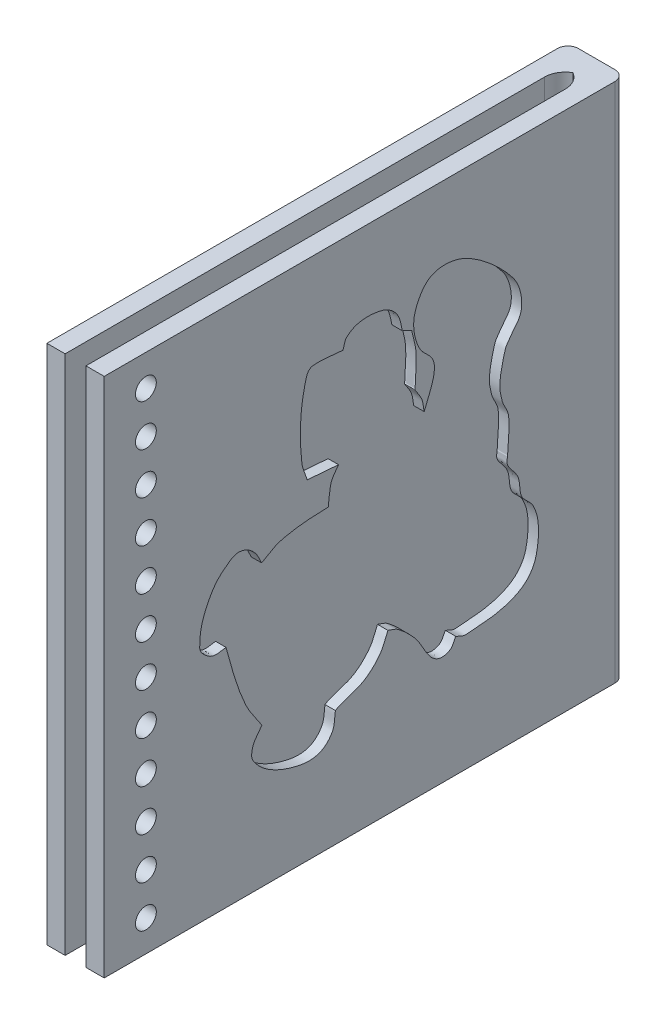
from build123d import *

# Parameters (mm, degrees)
SKETCH1_W           = 2.75
SKETCH1_H           = 25
BOSS_EXTRUDE1_DEPTH = 25
SKETCH2_W           = 1
SKETCH2_H           = 25
CUT_EXTRUDE1_DEPTH  = 24
FILLET2_R           = 1
CUT_EXTRUDE4_START  = 1.375
CUT_EXTRUDE4_DEPTH  = 0.5
FILLET3_R           = 0.5
SKETCH7_R           = 0.5
CUT_EXTRUDE5_DEPTH  = 10


with BuildPart() as part:
    # Sketch1 → Boss-Extrude1 (new body)
    with BuildSketch(Plane.XY):
        Rectangle(SKETCH1_W, SKETCH1_H)
    extrude(amount=BOSS_EXTRUDE1_DEPTH)

    # Sketch2 → Cut-Extrude1 (cut)
    with BuildSketch(Plane.XY.offset(25)):
        Rectangle(SKETCH2_W, SKETCH2_H)
    extrude(amount=-CUT_EXTRUDE1_DEPTH, mode=Mode.SUBTRACT)

    # Fillet2
    # the kernel refuses this fillet: 1 mm, written as the material it adds along each edge
    with BuildSketch(Plane(origin=(0.5, 12.5, 1), x_dir=(-1, 0, 0), z_dir=(0, -1, 0))) as fillet2_piece_1:
        with BuildLine():
            CenterArc((FILLET2_R, -FILLET2_R), FILLET2_R, 90, 90)
            Line((0, -FILLET2_R), (0, 0))
            Line((0, 0), (FILLET2_R, 0))
        make_face()
    extrude(amount=25)
    with BuildSketch(Plane(origin=(-0.5, -12.5, 1), x_dir=(0, 0, 1), z_dir=(0, 1, 0))) as fillet2_piece_2:
        with BuildLine():
            CenterArc((FILLET2_R, FILLET2_R), FILLET2_R, 180, 90)
            Line((0, FILLET2_R), (0, 0))
            Line((0, 0), (FILLET2_R, 0))
        make_face()
    extrude(amount=25)

    # Sketch6 → Cut-Extrude4 (cut)
    with BuildSketch(Plane(origin=(0, 0, 0), x_dir=(0, 0, -1), z_dir=(1, 0, 0)).offset(CUT_EXTRUDE4_START)):
        with BuildLine():
            Line((-13.75659598, 3.208094703), (-15.25659598, 3.328094703))
            add(Edge.make_bspline(
                [(-15.25659598, 3.328094703), (-15.34159598, 3.598094703), (-15.478059231, 3.857024807), (-15.51159598, 4.138094703), (-15.583906266, 4.744123764), (-15.610639421, 5.359017032), (-15.57159598, 5.968094703), (-15.535260245, 6.534932171), (-15.444836525, 7.102581248), (-15.28659598, 7.648094703), (-15.249167055, 7.777126), (-15.134978357, 7.91699683), (-15.00159598, 7.933094703), (-14.519450844, 7.991284633), (-14.03159598, 7.883094703), (-13.54659598, 7.858094703)],
                knots=[0, 0, 0, 0, 1, 1, 1, 2, 2, 2, 3, 3, 3, 4, 4, 4, 5, 5, 5, 5], degree=3))
            add(Edge.make_bspline(
                [(-13.54659598, 7.858094703), (-13.48159598, 8.013094703), (-13.476741249, 8.210895497), (-13.35159598, 8.323094703), (-13.166723721, 8.488842246), (-12.922480212, 8.603584636), (-12.67659598, 8.638094703), (-12.334048727, 8.686171511), (-11.974306488, 8.657718792), (-11.64159598, 8.563094703), (-11.412157478, 8.497841551), (-11.197922131, 8.353267216), (-11.04159598, 8.173094703), (-10.804491339, 7.899821558), (-10.762009421, 7.570161907), (-10.69659598, 7.243094703)],
                knots=[0, 0, 0, 0, 1, 1, 1, 2, 2, 2, 3, 3, 3, 4, 4, 4, 5, 5, 5, 5], degree=3))
            Line((-10.69659598, 7.243094703), (-10.24659598, 7.033094703))
            add(Edge.make_bspline(
                [(-10.24659598, 7.033094703), (-10.17659598, 6.693094703), (-10.059548306, 6.359466167), (-10.03659598, 6.013094703), (-10.004181978, 5.523937947), (-10.062196157, 5.032940237), (-10.08159598, 4.543094703), (-10.082221683, 4.5272957), (-10.10394565, 4.512094073), (-10.09659598, 4.498094703), (-9.99654865, 4.307528359), (-9.845622127, 4.143294274), (-9.76659598, 3.943094703), (-9.693507703, 3.757937733), (-9.68659598, 3.553094703), (-9.64659598, 3.358094703)],
                knots=[0, 0, 0, 0, 1, 1, 1, 2, 2, 2, 3, 3, 3, 4, 4, 4, 5, 5, 5, 5], degree=3))
            add(Edge.make_bspline(
                [(-9.64659598, 3.358094703), (-9.49659598, 3.768094703), (-9.288520046, 4.161304396), (-9.19659598, 4.588094703), (-9.146018675, 4.822917905), (-9.129038173, 5.088589637), (-9.22659598, 5.308094703), (-9.360760059, 5.60996388), (-9.700743832, 5.781830033), (-9.85659598, 6.073094703), (-10.011822034, 6.363189295), (-10.108585544, 6.690741208), (-10.14159598, 7.018094703), (-10.169907425, 7.298849867), (-10.138982996, 7.595146231), (-10.03659598, 7.858094703), (-9.913309024, 8.174718023), (-9.742862161, 8.495862148), (-9.48159598, 8.713094703), (-9.271261927, 8.887979197), (-8.975049206, 8.961142503), (-8.70159598, 8.968094703), (-8.364362395, 8.976668438), (-8.017342873, 8.900638863), (-7.71159598, 8.758094703), (-7.264149639, 8.549487963), (-6.857104165, 8.253592134), (-6.48159598, 7.933094703), (-6.067318292, 7.579507377), (-5.679685309, 7.186573078), (-5.35659598, 6.748094703), (-5.182509496, 6.511834474), (-5.069657746, 6.22576436), (-5.01159598, 5.938094703), (-4.957179545, 5.668486002), (-4.938146197, 5.373530177), (-5.02659598, 5.113094703), (-5.126052852, 4.82024947), (-5.382439364, 4.607007892), (-5.55159598, 4.348094703), (-5.627580506, 4.231791858), (-5.72326723, 4.121627122), (-5.76159598, 3.988094703), (-5.879821683, 3.576211609), (-5.985172366, 3.155455858), (-6.01659598, 2.728094703), (-6.035834132, 2.466455842), (-5.979192538, 2.201581794), (-5.91159598, 1.948094703), (-5.838150825, 1.67267537), (-5.628462394, 1.43635171), (-5.59659598, 1.153094703), (-5.536762273, 0.621239528), (-5.622321636, 0.082957769), (-5.64159598, -0.451905297), (-5.6423384, -0.472507452), (-5.65659598, -0.491289769), (-5.65659598, -0.511905297), (-5.65659598, -0.632009418), (-5.692304606, -0.763030895), (-5.64159598, -0.871905297), (-5.51688444, -1.139668311), (-5.2593142, -1.333876721), (-5.14659598, -1.606905297), (-5.029848014, -1.889694816), (-5.095826647, -2.229597824), (-4.96659598, -2.506905297), (-4.848153364, -2.76106341), (-4.555883166, -2.903088449), (-4.42659598, -3.151905297), (-4.285044038, -3.424326015), (-4.192864316, -3.730641264), (-4.17159598, -4.036905297), (-4.142053328, -4.462319485), (-4.174624176, -4.89783797), (-4.27659598, -5.311905297), (-4.342917918, -5.581212557), (-4.479525035, -5.842138451), (-4.66659598, -6.046905297), (-4.861147332, -6.259860155), (-5.118927955, -6.419416562), (-5.38659598, -6.526905297), (-5.763597062, -6.678299432), (-6.166720467, -6.778352077), (-6.57159598, -6.811905297), (-7.789953763, -6.912874174), (-7.65215886, -6.976623857), (-8.13159598, -6.736905297)],
                knots=[0, 0, 0, 0, 1, 1, 1, 2, 2, 2, 3, 3, 3, 4, 4, 4, 5, 5, 5, 6, 6, 6, 7, 7, 7, 8, 8, 8, 9, 9, 9, 10, 10, 10, 11, 11, 11, 12, 12, 12, 13, 13, 13, 14, 14, 14, 15, 15, 15, 16, 16, 16, 17, 17, 17, 18, 18, 18, 19, 19, 19, 20, 20, 20, 21, 21, 21, 22, 22, 22, 23, 23, 23, 24, 24, 24, 25, 25, 25, 26, 26, 26, 27, 27, 27, 28, 28, 28, 29, 29, 29, 29], degree=3))
            add(Edge.make_bspline(
                [(-8.13159598, -6.736905297), (-8.22159598, -6.876905297), (-8.26436961, -7.062730336), (-8.40159598, -7.156905297), (-8.540667701, -7.252346674), (-8.730903679, -7.293465735), (-8.89659598, -7.261905297), (-9.071012952, -7.228683016), (-9.23263856, -7.113062215), (-9.34659598, -6.976905297), (-9.625216523, -6.644008025), (-9.778150445, -6.219066296), (-10.05159598, -5.881905297), (-10.29661073, -5.579799732), (-10.582513679, -5.308058067), (-10.89159598, -5.071905297), (-11.034017705, -4.963088698), (-11.22159598, -4.931905297), (-11.38659598, -4.861905297)],
                knots=[0, 0, 0, 0, 1, 1, 1, 2, 2, 2, 3, 3, 3, 4, 4, 4, 5, 5, 5, 6, 6, 6, 6], degree=3))
            add(Edge.make_bspline(
                [(-11.38659598, -4.861905297), (-11.51659598, -5.131905297), (-11.594914061, -5.433595246), (-11.77659598, -5.671905297), (-11.986836337, -5.947675115), (-12.243642088, -6.199497636), (-12.54159598, -6.376905297), (-12.910187156, -6.596371798), (-13.344206699, -6.680329435), (-13.74159598, -6.841905297), (-13.799631993, -6.865502357), (-13.85159598, -6.901905297), (-13.90659598, -6.931905297)],
                knots=[0, 0, 0, 0, 1, 1, 1, 2, 2, 2, 3, 3, 3, 4, 4, 4, 4], degree=3))
            add(Edge.make_bspline(
                [(-13.90659598, -6.931905297), (-13.95659598, -7.201905297), (-13.926412623, -7.500136205), (-14.05659598, -7.741905297), (-14.184030979, -7.978570294), (-14.392540831, -8.195803702), (-14.64159598, -8.296905297), (-14.929428763, -8.413748308), (-15.26647199, -8.415209244), (-15.57159598, -8.356905297), (-16.067135074, -8.262216298), (-16.56050565, -8.100578757), (-16.99659598, -7.846905297), (-17.342055911, -7.645951481), (-17.662556052, -7.365551492), (-17.86659598, -7.021905297), (-17.971287551, -6.845582652), (-17.919234057, -6.600490138), (-17.85159598, -6.406905297), (-17.768347183, -6.168641498), (-17.57159598, -5.986905297), (-17.43159598, -5.776905297)],
                knots=[0, 0, 0, 0, 1, 1, 1, 2, 2, 2, 3, 3, 3, 4, 4, 4, 5, 5, 5, 6, 6, 6, 7, 7, 7, 7], degree=3))
            add(Edge.make_bspline(
                [(-17.43159598, -5.776905297), (-17.68659598, -5.376905297), (-17.996656257, -5.007078642), (-18.19659598, -4.576905297), (-18.625110168, -3.65495053), (-18.894637192, -2.664250752), (-19.15659598, -1.681905297)],
                knots=[0, 0, 0, 0, 1, 1, 1, 2, 2, 2, 2], degree=3))
            add(Edge.make_bspline(
                [(-19.15659598, -1.681905297), (-19.36159598, -1.696905297), (-19.57154848, -1.774138734), (-19.77159598, -1.726905297), (-19.95111846, -1.684518045), (-20.106164006, -1.557337271), (-20.23659598, -1.426905297), (-20.328315662, -1.335185615), (-20.412413923, -1.21154908), (-20.41659598, -1.081905297), (-20.42797332, -0.729207755), (-20.389799692, -0.367787652), (-20.28159598, -0.031905297), (-20.146522308, 0.387385894), (-19.953456189, 0.795222053), (-19.69659598, 1.153094703), (-19.500477146, 1.426338922), (-19.224266505, 1.638294598), (-18.94659598, 1.828094703), (-18.82125706, 1.913769408), (-18.663240825, 1.970432357), (-18.51159598, 1.963094703), (-18.336230654, 1.954609284), (-18.156508924, 1.889157741), (-18.01659598, 1.783094703), (-17.681073904, 1.528747323), (-17.601852143, 1.300857713), (-17.44659598, 0.973094703)],
                knots=[0, 0, 0, 0, 1, 1, 1, 2, 2, 2, 3, 3, 3, 4, 4, 4, 5, 5, 5, 6, 6, 6, 7, 7, 7, 8, 8, 8, 9, 9, 9, 9], degree=3))
            add(Edge.make_bspline(
                [(-17.44659598, 0.973094703), (-17.14159598, 1.128094703), (-16.862138601, 1.349824799), (-16.53159598, 1.438094703), (-15.792748628, 1.63540053), (-15.016055345, 1.672433639), (-14.25159598, 1.693094703)],
                knots=[0, 0, 0, 0, 1, 1, 1, 2, 2, 2, 2], degree=3))
            add(Edge.make_bspline(
                [(-14.25159598, 1.693094703), (-14.20159598, 2.018094703), (-14.203720501, 2.355531778), (-14.10159598, 2.668094703), (-14.035257059, 2.871132009), (-13.87159598, 3.028094703), (-13.75659598, 3.208094703)],
                knots=[0, 0, 0, 0, 1, 1, 1, 2, 2, 2, 2], degree=3))
        make_face()
    extrude(amount=-CUT_EXTRUDE4_DEPTH, mode=Mode.SUBTRACT)

    # Fillet3
    fillet3_edges = [part.edges().sort_by_distance(p)[0] for p in [
        (1.375, 0, 0),
        (-1.375, 0, 0),
    ]]
    fillet(fillet3_edges, radius=FILLET3_R)

    # Sketch7 → Cut-Extrude5 (cut)
    with BuildSketch(Plane(origin=(1.375, 0, 0), x_dir=(0, 0, -1), z_dir=(1, 0, 0))):
        with Locations((-23, -11)):
            Circle(SKETCH7_R)
        with Locations((-23, -9)):
            Circle(SKETCH7_R)
        with Locations((-23, -7)):
            Circle(SKETCH7_R)
        with Locations((-23, -5)):
            Circle(SKETCH7_R)
        with Locations((-23, -3)):
            Circle(SKETCH7_R)
        with Locations((-23, -1)):
            Circle(SKETCH7_R)
        with Locations((-23, 1)):
            Circle(SKETCH7_R)
        with Locations((-23, 3)):
            Circle(SKETCH7_R)
        with Locations((-23, 5)):
            Circle(SKETCH7_R)
        with Locations((-23, 7)):
            Circle(SKETCH7_R)
        with Locations((-23, 9)):
            Circle(SKETCH7_R)
        with Locations((-23, 11)):
            Circle(SKETCH7_R)
    extrude(amount=-CUT_EXTRUDE5_DEPTH, mode=Mode.SUBTRACT)


solid = part.part
